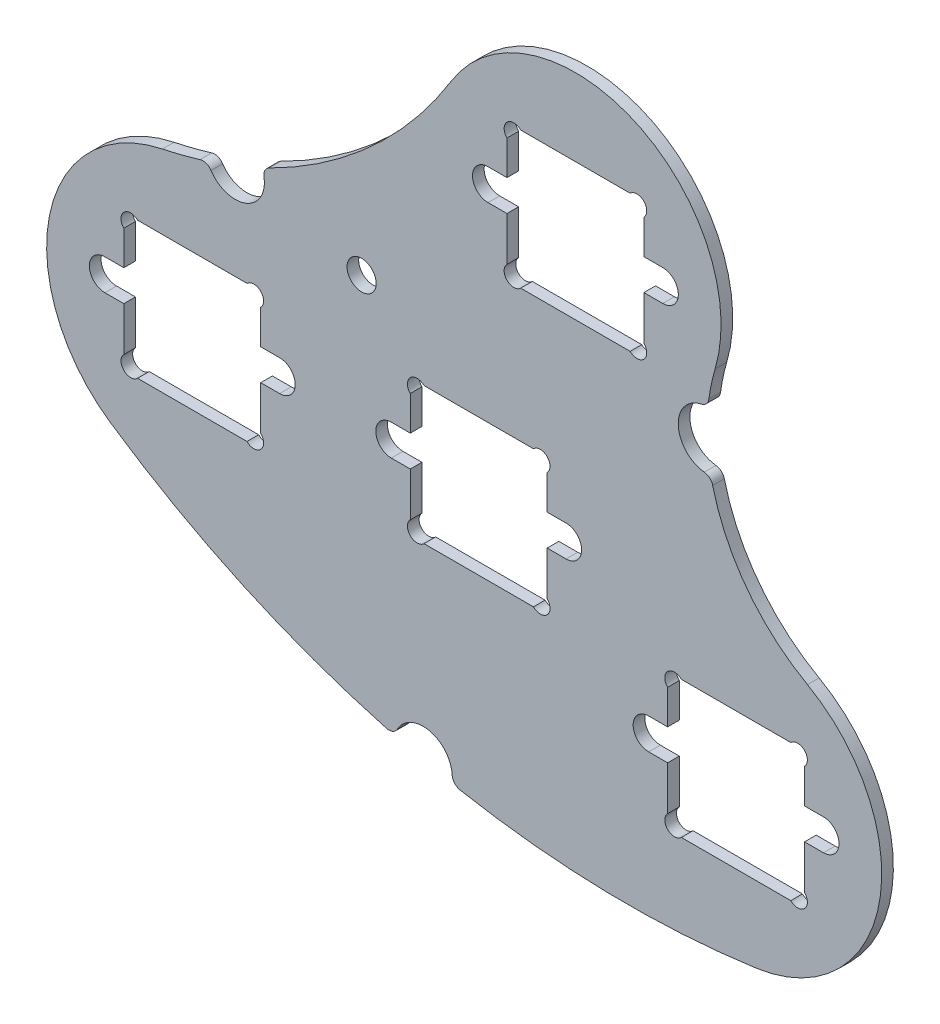
from build123d import *
from build123d.topology import SkipClean

# Parameters (mm, degrees)
BOSS_EXTRUDE1_DEPTH   = 1.2
SKETCH8_3_R           = 3
CUT_EXTRUDE1_DEPTH    = 182.287051241
SKETCH16_R            = 1.6
SKETCH16_W            = 18
SKETCH16_H            = 3.2
CUT_EXTRUDE2_DEPTH    = 182.287051241
CUT_EXTRUDE3_DEPTH    = 182.287051241
SKETCH9_W             = 14.1
SKETCH9_H             = 14.1
CUT_EXTRUDE4_DEPTH    = 182.287051241
F_3_0MM_DOWEL_HOLE1_D = 3
FILLET1_R             = 1


with BuildPart() as part:
    # Sketch8 → Boss-Extrude1 (new body)
    with BuildSketch(Plane.XY):
        with BuildLine():
            ThreePointArc((73.852303576, 63.794594289), (73.863549821, 63.839319131), (73.875482243, 63.883865813))
            ThreePointArc((73.875482243, 63.883865813), (76.767270103, 63.085390407), (79.729789892, 62.612657392))
            ThreePointArc((79.729789892, 62.612657392), (79.717062502, 62.538833177), (79.702495752, 62.465349771))
            ThreePointArc((79.702495752, 62.465349771), (95.373691885, 60.7573177), (111.111302129, 61.669121188))
            ThreePointArc((111.111302129, 61.669121188), (123.74416397, 73.75113123), (116.356165737, 89.593531525))
            ThreePointArc((116.356165737, 89.593531525), (107.510169126, 99.635128091), (106.844308874, 113.000828513))
            ThreePointArc((106.844308874, 113.000828513), (98.551785503, 130.943955248), (79.67265081, 125.087333856))
            ThreePointArc((79.67265081, 125.087333856), (66.957923375, 111.551078569), (49.923987164, 104.152462611))
            ThreePointArc((49.923987164, 104.152462611), (38.279791522, 92.371702096), (44.581782069, 77.053134095))
            ThreePointArc((44.581782069, 77.053134095), (58.651333394, 69.17496271), (73.852303576, 63.794594289))
        make_face()
        with BuildLine():
            ThreePointArc((56.72077423, 104.000844147), (56.721683918, 104.00117089), (56.7225936, 104.001497652))
            ThreePointArc((56.7225936, 104.001497652), (56.755397532, 103.992206145), (56.788325126, 103.983362865))
            ThreePointArc((56.788325126, 103.983362865), (56.754559843, 103.992142785), (56.72077423, 104.000844147))
        make_face(mode=Mode.SUBTRACT)
        with BuildLine():
            ThreePointArc((109.376341775, 92.015545509), (109.37615287, 92.017539878), (109.375963817, 92.019534234))
            ThreePointArc((109.375963817, 92.019534234), (109.377797318, 92.017499849), (109.379631064, 92.015465685))
            ThreePointArc((109.379631064, 92.015465685), (109.377986421, 92.015505684), (109.376341775, 92.015545509))
        make_face(mode=Mode.SUBTRACT)
        with BuildLine():
            ThreePointArc((103.532400156, 106.396636288), (103.543227812, 106.407709628), (103.554044399, 106.418793781))
            ThreePointArc((103.554044399, 106.418793781), (103.552293137, 106.396310438), (103.550744757, 106.373812212))
            ThreePointArc((103.550744757, 106.373812212), (103.541575551, 106.385226737), (103.532400156, 106.396636288))
        make_face(mode=Mode.SUBTRACT)
        with BuildLine():
            ThreePointArc((104.021801646, 107.681154775), (104.021865069, 107.684582448), (104.021929019, 107.688010111))
            ThreePointArc((104.021929019, 107.688010111), (104.063142491, 107.7381429), (104.104138674, 107.788453533))
            ThreePointArc((104.104138674, 107.788453533), (104.062244422, 107.735361058), (104.021801646, 107.681154775))
        make_face(mode=Mode.SUBTRACT)
    extrude(amount=BOSS_EXTRUDE1_DEPTH)

    # Sketch8<3> → Cut-Extrude1 (cut, through all)
    with SkipClean():  # the faces are left unmerged after this step: merging them gives an invalid solid
        with BuildSketch(Plane.XY):
            with Locations((106.04559389, 106.21341333)):
                Circle(SKETCH8_3_R)
            with Locations((76.767270103, 63.085390407)):
                Circle(SKETCH8_3_R)
            with Locations((57.420286528, 106.402169345)):
                Circle(SKETCH8_3_R)
        extrude(amount=CUT_EXTRUDE1_DEPTH, mode=Mode.SUBTRACT)

    # Sketch16 → Cut-Extrude2 (cut, through all)
    with SkipClean():  # the faces are left unmerged after this step: merging them gives an invalid solid
        with BuildSketch(Plane.XY):
            with Locations((43.996556322, 89.970524089)):
                Circle(SKETCH16_R)
            with Locations((61.996556322, 89.970524089)):
                Circle(SKETCH16_R)
            with Locations((73.496556322, 89.970524089)):
                Circle(SKETCH16_R)
            with Locations((91.496556322, 89.970524089)):
                Circle(SKETCH16_R)
            with Locations((100.001946024, 77.020067852)):
                Circle(SKETCH16_R)
            with Locations((118.001946024, 77.020067852)):
                Circle(SKETCH16_R)
            with Locations((83.45540719, 117.738694526)):
                Circle(SKETCH16_R)
            with Locations((101.45540719, 117.738694526)):
                Circle(SKETCH16_R)
            with Locations((52.996556322, 89.970524089)):
                Rectangle(SKETCH16_W, SKETCH16_H)
            with Locations((82.496556322, 89.970524089)):
                Rectangle(SKETCH16_W, SKETCH16_H)
            with Locations((109.001946024, 77.020067852)):
                Rectangle(SKETCH16_W, SKETCH16_H)
            with Locations((92.45540719, 117.738694526)):
                Rectangle(SKETCH16_W, SKETCH16_H)
        extrude(amount=CUT_EXTRUDE2_DEPTH, mode=Mode.SUBTRACT)

    # Sketch14 → Cut-Extrude3 (cut, through all)
    with SkipClean():  # the faces are left unmerged after this step: merging them gives an invalid solid
        with BuildSketch(Plane.XY):
            with BuildLine():
                Line((45.946556322, 95.106310527), (47.360769884, 96.520524089))
                ThreePointArc((47.360769884, 96.520524089), (45.946556322, 96.520524089), (45.946556322, 95.106310527))
            make_face()
            with BuildLine():
                Line((45.946556322, 83.834737652), (47.360769884, 82.420524089))
                ThreePointArc((47.360769884, 82.420524089), (45.946556322, 82.420524089), (45.946556322, 83.834737652))
            make_face()
            with BuildLine():
                Line((58.63234276, 82.420524089), (60.046556322, 83.834737652))
                ThreePointArc((60.046556322, 83.834737652), (60.046556322, 82.420524089), (58.63234276, 82.420524089))
            make_face()
            with BuildLine():
                Line((58.63234276, 96.520524089), (60.046556322, 95.106310527))
                ThreePointArc((60.046556322, 95.106310527), (60.046556322, 96.520524089), (58.63234276, 96.520524089))
            make_face()
            with BuildLine():
                Line((85.40540719, 111.602908088), (86.819620752, 110.188694526))
                ThreePointArc((86.819620752, 110.188694526), (85.40540719, 110.188694526), (85.40540719, 111.602908088))
            make_face()
            with BuildLine():
                Line((98.091193628, 110.188694526), (99.50540719, 111.602908088))
                ThreePointArc((99.50540719, 111.602908088), (99.50540719, 110.188694526), (98.091193628, 110.188694526))
            make_face()
            with BuildLine():
                Line((98.091193628, 124.288694526), (99.50540719, 122.874480963))
                ThreePointArc((99.50540719, 122.874480963), (99.50540719, 124.288694526), (98.091193628, 124.288694526))
            make_face()
            with BuildLine():
                Line((85.40540719, 122.874480963), (86.819620752, 124.288694526))
                ThreePointArc((86.819620752, 124.288694526), (85.40540719, 124.288694526), (85.40540719, 122.874480963))
            make_face()
            with BuildLine():
                Line((101.951946024, 82.155854289), (103.366159586, 83.570067852))
                ThreePointArc((103.366159586, 83.570067852), (101.951946024, 83.570067852), (101.951946024, 82.155854289))
            make_face()
            with BuildLine():
                Line((101.951946024, 70.884281414), (103.366159586, 69.470067852))
                ThreePointArc((103.366159586, 69.470067852), (101.951946024, 69.470067852), (101.951946024, 70.884281414))
            make_face()
            with BuildLine():
                Line((114.637732461, 69.470067852), (116.051946024, 70.884281414))
                ThreePointArc((116.051946024, 70.884281414), (116.051946024, 69.470067852), (114.637732461, 69.470067852))
            make_face()
            with BuildLine():
                Line((116.051946024, 82.155854289), (114.637732461, 83.570067852))
                ThreePointArc((114.637732461, 83.570067852), (116.051946024, 83.570067852), (116.051946024, 82.155854289))
            make_face()
            with BuildLine():
                Line((76.860769884, 96.520524089), (75.446556322, 95.106310527))
                ThreePointArc((75.446556322, 95.106310527), (75.446556322, 96.520524089), (76.860769884, 96.520524089))
            make_face()
            with BuildLine():
                Line((88.13234276, 96.520524089), (89.546556322, 95.106310527))
                ThreePointArc((89.546556322, 95.106310527), (89.546556322, 96.520524089), (88.13234276, 96.520524089))
            make_face()
            with BuildLine():
                Line((89.546556322, 83.834737652), (88.13234276, 82.420524089))
                ThreePointArc((88.13234276, 82.420524089), (89.546556322, 82.420524089), (89.546556322, 83.834737652))
            make_face()
            with BuildLine():
                Line((75.446556322, 83.834737652), (76.860769884, 82.420524089))
                ThreePointArc((76.860769884, 82.420524089), (75.446556322, 82.420524089), (75.446556322, 83.834737652))
            make_face()
        extrude(amount=CUT_EXTRUDE3_DEPTH, mode=Mode.SUBTRACT)

    # Sketch9 → Cut-Extrude4 (cut, through all)
    with SkipClean():  # the faces are left unmerged after this step: merging them gives an invalid solid
        with BuildSketch(Plane.XY):
            with Locations((52.996556322, 89.470524089)):
                Rectangle(SKETCH9_W, SKETCH9_H)
            with Locations((82.496556322, 89.470524089)):
                Rectangle(SKETCH9_W, SKETCH9_H)
            with Locations((109.001946024, 76.520067852)):
                Rectangle(SKETCH9_W, SKETCH9_H)
            with Locations((92.45540719, 117.238694526)):
                Rectangle(SKETCH9_W, SKETCH9_H)
        extrude(amount=CUT_EXTRUDE4_DEPTH, mode=Mode.SUBTRACT)

    # Ø3.0mm Dowel Hole1 (through all)
    with Locations(Plane.XY.offset(1.2)):
        with Locations((70.435309654, 103.157249982)):
            Hole(F_3_0MM_DOWEL_HOLE1_D / 2)

    # Fillet1
    fillet1_edges = [part.edges().sort_by_distance(p)[0] for p in [
        (79.702495752, 62.465349771, 0.6),
        (73.852303576, 63.794594289, 0.6),
        (106.42311517, 103.237261841, 0.6),
        (106.111211206, 109.212695638, 0.6),
        (54.596217873, 105.389926178, 0.6),
        (60.17229201, 107.596516793, 0.6),
    ]]
    fillet(fillet1_edges, radius=FILLET1_R)


solid = part.part
